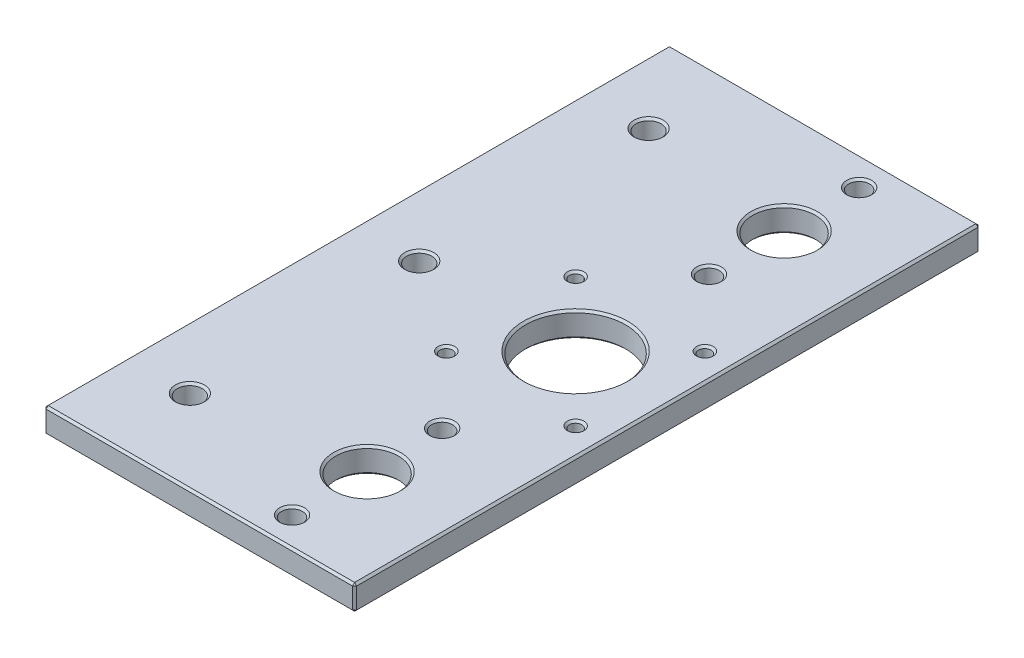
from build123d import *

# Parameters (mm, degrees)
CROQUIS1_W              = 74.5
CROQUIS1_H              = 150
CROQUIS1_R              = 1.5
CROQUIS1_R_2            = 3
CROQUIS1_R_3            = 12
CROQUIS1_R_4            = 7.5
CROQUIS1_R_5            = 2.5
SALIENTE_EXTRUIR1_DEPTH = 6
CHAFL_N1_SIZE           = 0.5


with BuildPart() as part:
    # Croquis1 → Saliente-Extruir1 (new body)
    with BuildSketch(Plane(origin=(0, 0, 0), x_dir=(1, 0, 0), z_dir=(0, 1, 0))):
        with Locations((-2.478313692, -1.041413592)):
            Rectangle(CROQUIS1_W, CROQUIS1_H)
        with Locations((-2.728313692, 14.458586408)):
            Circle(CROQUIS1_R, mode=Mode.SUBTRACT)
        with Locations((28.271686308, 14.458586408)):
            Circle(CROQUIS1_R, mode=Mode.SUBTRACT)
        with Locations((-2.728313692, -16.541413592)):
            Circle(CROQUIS1_R, mode=Mode.SUBTRACT)
        with Locations((28.271686308, -16.541413592)):
            Circle(CROQUIS1_R, mode=Mode.SUBTRACT)
        with Locations((-24.728313692, 53.958586408)):
            Circle(CROQUIS1_R_2, mode=Mode.SUBTRACT)
        with Locations((-24.728313692, -56.041413592)):
            Circle(CROQUIS1_R_2, mode=Mode.SUBTRACT)
        with Locations((12.771686308, -1.041413592)):
            Circle(CROQUIS1_R_3, mode=Mode.SUBTRACT)
        with Locations((-24.728313692, -1.041413592)):
            Circle(CROQUIS1_R_2, mode=Mode.SUBTRACT)
        with Locations((12.771686308, -51.041413592)):
            Circle(CROQUIS1_R_4, mode=Mode.SUBTRACT)
        with Locations((12.771686308, 48.958586408)):
            Circle(CROQUIS1_R_4, mode=Mode.SUBTRACT)
        with Locations((12.771686308, 66.958586408)):
            Circle(CROQUIS1_R_5, mode=Mode.SUBTRACT)
        with Locations((12.771686308, 30.958586408)):
            Circle(CROQUIS1_R_5, mode=Mode.SUBTRACT)
        with Locations((12.771686308, -33.041413592)):
            Circle(CROQUIS1_R_5, mode=Mode.SUBTRACT)
        with Locations((12.771686308, -69.041413592)):
            Circle(CROQUIS1_R_5, mode=Mode.SUBTRACT)
    extrude(amount=SALIENTE_EXTRUIR1_DEPTH)

    # Chaflán1
    chafl_n1_edges = [part.edges().sort_by_distance(p)[0] for p in [
        (26.771686308, 0, 16.541413592),
        (26.771686308, 0, -14.458586408),
        (-4.228313692, 0, -14.458586408),
        (-4.228313692, 0, 16.541413592),
        (26.771686308, 6, 16.541413592),
        (26.771686308, 6, -14.458586408),
        (-39.728313692, 3, -73.958586408),
        (-39.728313692, 3, 76.041413592),
        (34.771686308, 3, 76.041413592),
        (-2.478313692, 0, 76.041413592),
        (34.771686308, 0, 1.041413592),
        (-39.728313692, 0, 1.041413592),
        (-2.478313692, 0, -73.958586408),
        (34.771686308, 3, -73.958586408),
        (-2.478313692, 6, -73.958586408),
        (34.771686308, 6, 1.041413592),
        (-2.478313692, 6, 76.041413592),
        (-39.728313692, 6, 1.041413592),
        (-4.228313692, 6, -14.458586408),
        (-4.228313692, 6, 16.541413592),
        (-27.728313692, 0, 56.041413592),
        (-27.728313692, 0, -53.958586408),
        (-27.728313692, 6, 56.041413592),
        (-27.728313692, 6, -53.958586408),
        (0.771686308, 0, 1.041413592),
        (0.771686308, 6, 1.041413592),
        (5.271686308, 0, -48.958586408),
        (-27.728313692, 0, 1.041413592),
        (5.271686308, 0, 51.041413592),
        (5.271686308, 6, -48.958586408),
        (-27.728313692, 6, 1.041413592),
        (5.271686308, 6, 51.041413592),
        (10.271686308, 0, 69.041413592),
        (10.271686308, 0, -30.958586408),
        (10.271686308, 0, -66.958586408),
        (10.271686308, 0, 33.041413592),
        (10.271686308, 6, 69.041413592),
        (10.271686308, 6, -30.958586408),
        (10.271686308, 6, -66.958586408),
        (10.271686308, 6, 33.041413592),
    ]]
    chamfer(chafl_n1_edges, length=CHAFL_N1_SIZE)


solid = part.part
